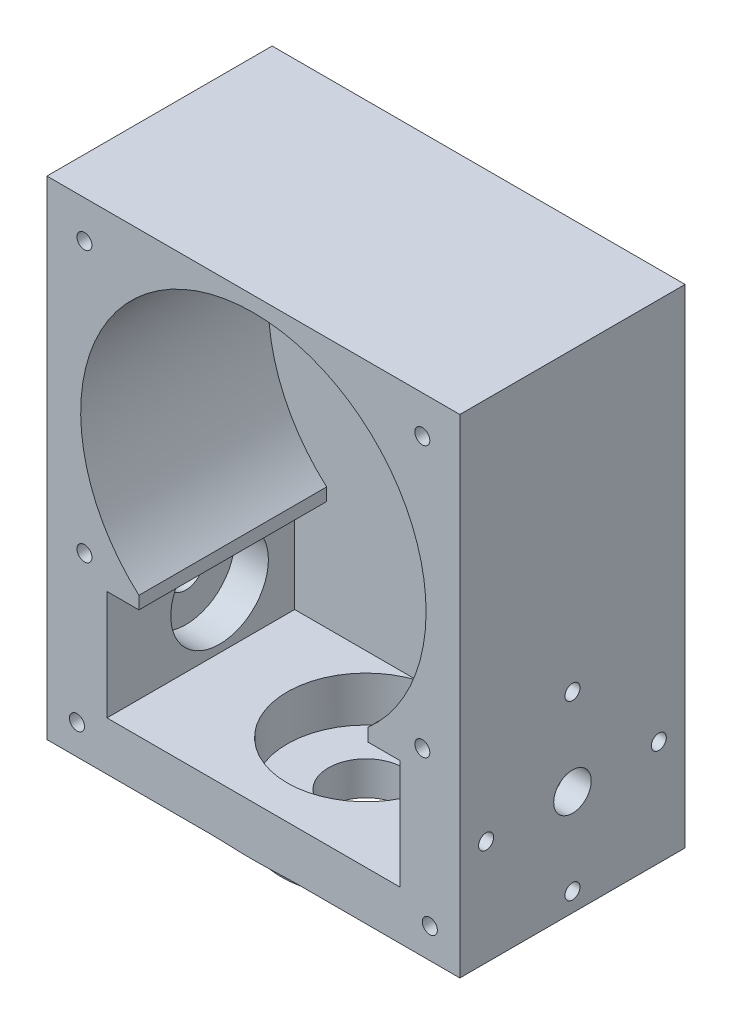
from build123d import *

# Parameters (mm, degrees)
SKETCH1_W           = 110
SKETCH1_H           = 130
BOSS_EXTRUDE1_DEPTH = 5
SKETCH10_W          = 110
SKETCH10_H          = 60
BOSS_EXTRUDE4_DEPTH = 13
SKETCH6_R           = 21
CUT_EXTRUDE2_DEPTH  = 30
BOSS_EXTRUDE6_START = 12
SKETCH16_R          = 27.5
SKETCH16_R_2        = 21
BOSS_EXTRUDE6_DEPTH = 12
BOSS_EXTRUDE7_START = 5
SKETCH17_R          = 27.5
SKETCH17_R_2        = 10
BOSS_EXTRUDE7_DEPTH = 5
BOSS_EXTRUDE8_DEPTH = 50
SKETCH19_R          = 10
CUT_EXTRUDE3_DEPTH  = 50
SKETCH21_R          = 21
CUT_EXTRUDE4_DEPTH  = 12
BOSS_EXTRUDE9_START = 8
SKETCH22_R          = 22.5
SKETCH22_R_2        = 10
BOSS_EXTRUDE9_DEPTH = 8
FILLET1_R           = 10
FILLET2_R           = 10
FILLET3_R           = 2
SKETCH23_R          = 13
CUT_EXTRUDE5_DEPTH  = 9
SKETCH24_R          = 5
CUT_EXTRUDE6_DEPTH  = 9
SKETCH27_R          = 2
CUT_EXTRUDE7_DEPTH  = 10
SKETCH28_R          = 2
CUT_EXTRUDE8_DEPTH  = 10


with BuildPart() as part:
    # Sketch1 → Boss-Extrude1 (new, symmetric)
    with BuildSketch(Plane.XY):
        with Locations((0, 5)):
            Rectangle(SKETCH1_W, SKETCH1_H)
    extrude(amount=BOSS_EXTRUDE1_DEPTH, both=True)

    # Sketch10 → Boss-Extrude4 (add)
    with BuildSketch(Plane.XZ.offset(60)):
        with Locations((0, 25)):
            Rectangle(SKETCH10_W, SKETCH10_H)
    extrude(amount=-BOSS_EXTRUDE4_DEPTH)

    # Sketch6 → Cut-Extrude2 (cut)
    with BuildSketch(Plane(origin=(0, 0, -5), x_dir=(-1, 0, 0), z_dir=(0, 0, -1))):
        with Locations((0, 20)):
            Circle(SKETCH6_R)
    extrude(amount=-CUT_EXTRUDE2_DEPTH, mode=Mode.SUBTRACT)

    # Sketch16 → Boss-Extrude6 (add)
    with BuildSketch(Plane(origin=(0, 0, -5), x_dir=(-1, 0, 0), z_dir=(0, 0, -1)).offset(BOSS_EXTRUDE6_START)):
        with Locations((0, 20)):
            Circle(SKETCH16_R)
        with Locations((0, 20)):
            Circle(SKETCH16_R_2, mode=Mode.SUBTRACT)
    extrude(amount=-BOSS_EXTRUDE6_DEPTH)

    # Sketch17 → Boss-Extrude7 (add)
    with BuildSketch(Plane(origin=(0, 0, -17), x_dir=(-1, 0, 0), z_dir=(0, 0, -1)).offset(BOSS_EXTRUDE7_START)):
        with Locations((0, 20)):
            Circle(SKETCH17_R)
        with Locations((0, 20)):
            Circle(SKETCH17_R_2, mode=Mode.SUBTRACT)
    extrude(amount=-BOSS_EXTRUDE7_DEPTH)

    # Sketch18 → Boss-Extrude8 (add)
    with BuildSketch(Plane.XY.offset(5)):
        with BuildLine():
            Line((-55, -47), (-39, -47))
            Line((-39, -47), (-39, -17.822222222))
            Line((-39, -17.822222222), (-30.482216757, -17.822222222))
            Line((-30.482216757, -17.822222222), (-30.482216757, -14.450463881))
            ThreePointArc((-30.482216757, -14.450463881), (0, 66), (30.482216757, -14.450463881))
            Line((30.482216757, -14.450463881), (30.482216757, -17.822222222))
            Line((30.482216757, -17.822222222), (39, -17.822222222))
            Line((39, -17.822222222), (39, -47))
            Line((39, -47), (55, -47))
            Line((55, -47), (55, 70))
            Line((55, 70), (-55, 70))
            Line((-55, 70), (-55, -47))
        make_face()
    extrude(amount=BOSS_EXTRUDE8_DEPTH)

    # Sketch19 → Cut-Extrude3 (cut)
    with BuildSketch(Plane.XZ.offset(60)):
        with Locations(Location((0, 25, 0), (0, 0, 270))):
            Circle(SKETCH19_R)
    extrude(amount=-CUT_EXTRUDE3_DEPTH, mode=Mode.SUBTRACT)

    # Sketch21 → Cut-Extrude4 (cut)
    with BuildSketch(Plane(origin=(0, -47, 0), x_dir=(1, 0, 0), z_dir=(0, 1, 0))):
        with Locations(Location((0, -25, 0), (0, 0, 270))):
            Circle(SKETCH21_R)
    extrude(amount=-CUT_EXTRUDE4_DEPTH, mode=Mode.SUBTRACT)

    # Sketch22 → Boss-Extrude9 (add)
    with BuildSketch(Plane.XZ.offset(60).offset(BOSS_EXTRUDE9_START)):
        with Locations(Location((0, 25, 0), (0, 0, 270))):
            Circle(SKETCH22_R)
        with Locations(Location((0, 25, 0), (0, 0, 270))):
            Circle(SKETCH22_R_2, mode=Mode.SUBTRACT)
    extrude(amount=-BOSS_EXTRUDE9_DEPTH)

    # Fillet1
    # the kernel refuses this fillet: 10 mm, written as the material it adds along each edge
    with BuildSketch(Plane(origin=(0, -60, 25), x_dir=(0, 0, -1), z_dir=(-1, 0, 0))) as fillet1_piece_1_section:
        with BuildLine():
            CenterArc((32.297958971, 10), FILLET1_R, 191.536959033, 78.463040967)
            Line((22.5, 8), (22.5, 0))
            Line((22.5, 0), (32.297958971, 0))
        make_face()
    fillet1_piece_1 = revolve(axis=Axis((0, -60, 25), (0, -1, 0)), mode=Mode.PRIVATE)
    fillet1_piece_1 = split(fillet1_piece_1, bisect_by=Plane(origin=(0, -60, 55), z_dir=(0, 0, -1)), keep=Keep.TOP, mode=Mode.PRIVATE)
    fillet1_piece_1 = split(fillet1_piece_1, bisect_by=Plane(origin=(0, -60, -5), z_dir=(0, 0, 1)), keep=Keep.TOP, mode=Mode.PRIVATE)
    add(fillet1_piece_1)

    # Fillet2
    fillet2_edges = [part.edges().sort_by_distance(p)[0] for p in [
        (27.5, 20, -5),
    ]]
    fillet(fillet2_edges, radius=FILLET2_R)

    # Fillet3
    fillet3_edges = [part.edges().sort_by_distance(p)[0] for p in [
        (27.5, 20, -22),
    ]]
    fillet(fillet3_edges, radius=FILLET3_R)

    # Sketch23 → Cut-Extrude5 (cut)
    with BuildSketch(Plane(origin=(-39, 0, 0), x_dir=(0, 0, -1), z_dir=(1, 0, 0))):
        with Locations((-25, -32)):
            Circle(SKETCH23_R)
    cut_extrude5 = extrude(amount=-CUT_EXTRUDE5_DEPTH, mode=Mode.SUBTRACT)

    # Sketch24 → Cut-Extrude6 (cut)
    with BuildSketch(Plane(origin=(-48, 0, 0), x_dir=(0, 0, -1), z_dir=(1, 0, 0))):
        with Locations((-25, -32)):
            Circle(SKETCH24_R)
    cut_extrude6 = extrude(amount=-CUT_EXTRUDE6_DEPTH, mode=Mode.SUBTRACT)

    # Mirror1: Cut-Extrude5, Cut-Extrude6 across plane
    add(cut_extrude5.mirror(Plane(origin=(0, 0, 0), x_dir=(0, 0, 1), z_dir=(1, 0, 0))), mode=Mode.SUBTRACT)
    add(cut_extrude6.mirror(Plane(origin=(0, 0, 0), x_dir=(0, 0, 1), z_dir=(1, 0, 0))), mode=Mode.SUBTRACT)

    # Sketch27 → Cut-Extrude7 (cut)
    with BuildSketch(Plane.ZY.offset(55)):
        with Locations((2, -32)):
            Circle(SKETCH27_R)
        with Locations(Location((48, -32, 0), (0, 0, 180))):
            Circle(SKETCH27_R)
        with Locations((25, -55)):
            Circle(SKETCH27_R)
        with Locations(Location((25, -9, 0), (0, 0, 180))):
            Circle(SKETCH27_R)
    cut_extrude7 = extrude(amount=-CUT_EXTRUDE7_DEPTH, mode=Mode.SUBTRACT)

    # Mirror2: Cut-Extrude7 across plane
    add(cut_extrude7.mirror(Plane(origin=(0, 0, 0), x_dir=(0, 0, 1), z_dir=(1, 0, 0))), mode=Mode.SUBTRACT)

    # Sketch28 → Cut-Extrude8 (cut)
    with BuildSketch(Plane.XY.offset(55)):
        with Locations((-45, 60)):
            Circle(SKETCH28_R)
        with Locations((-45, -12)):
            Circle(SKETCH28_R)
        with Locations((-47, -52)):
            Circle(SKETCH28_R)
        with Locations(Location((47, -52, 0), (0, 0, 180))):
            Circle(SKETCH28_R)
        with Locations(Location((45, -12, 0), (0, 0, 180))):
            Circle(SKETCH28_R)
        with Locations(Location((45, 60, 0), (0, 0, 180))):
            Circle(SKETCH28_R)
    extrude(amount=-CUT_EXTRUDE8_DEPTH, mode=Mode.SUBTRACT)


solid = part.part
